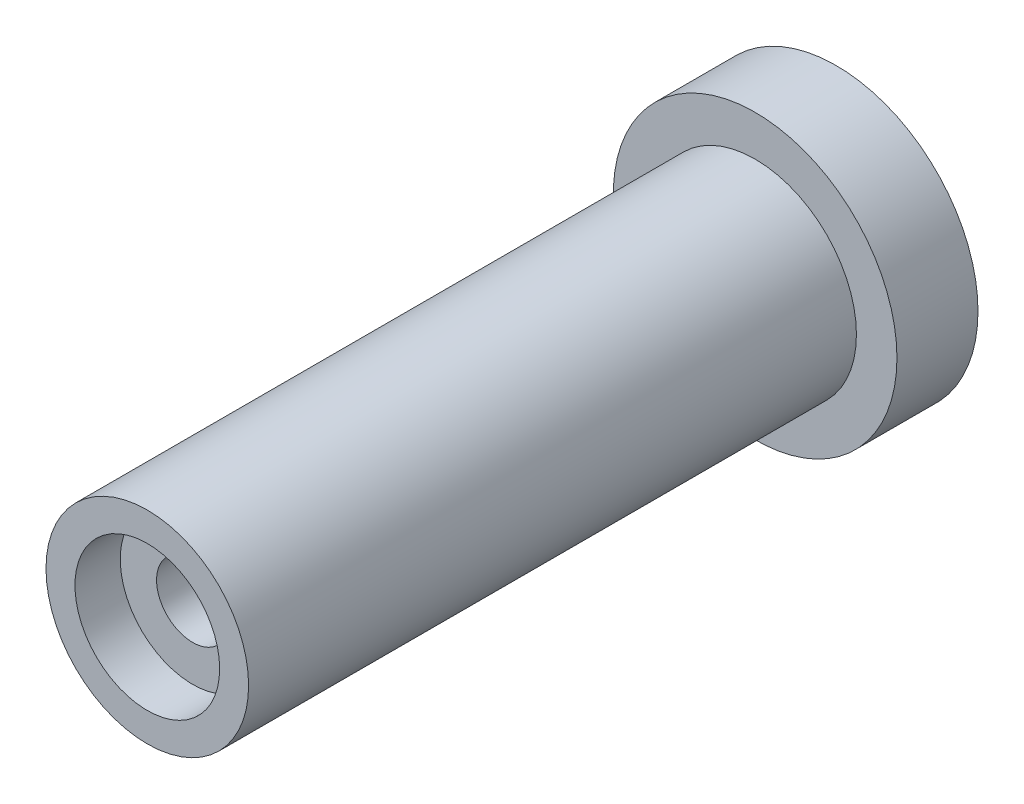
from build123d import *

# Parameters (mm, degrees)
ESQUISSE1_R                                      = 2.5
BOSS_EXTRU_1_DEPTH                               = 15
ESQUISSE2_R                                      = 3.5
BOSS_EXTRU_2_DEPTH                               = 2
CHAMBRAGE_POUR_VIS_T_TE_RONDE_BOMB_E_D           = 1.778
CHAMBRAGE_POUR_VIS_T_TE_RONDE_BOMB_E_DEPTH       = 6
CHAMBRAGE_POUR_VIS_T_TE_RONDE_BOMB_E_CBORE_D     = 3.57124
CHAMBRAGE_POUR_VIS_T_TE_RONDE_BOMB_E_CBORE_DEPTH = 1.1176
CHAMBRAGE_POUR_VIS_T_TE_RONDE_BOMB_E_TIP         = 0.53416509


with BuildPart() as part:
    # Esquisse1 → Boss.-Extru.1 (new body)
    with BuildSketch(Plane.XY):
        Circle(ESQUISSE1_R)
    extrude(amount=BOSS_EXTRU_1_DEPTH)

    # Esquisse2 → Boss.-Extru.2 (add)
    with BuildSketch(Plane.XY):
        Circle(ESQUISSE2_R)
        Polygon((-1.718731116, -0.115769453), (-1.718731116, 0.115769453), (-0.115769453, 0.115769453), (-0.115769453, 1.718731116), (0.115769453, 1.718731116), (0.115769453, 0.115769453), (1.718731116, 0.115769453), (1.718731116, -0.115769453), (0.115769453, -0.115769453), (0.115769453, -1.718731116), (-0.115769453, -1.718731116), (-0.115769453, -0.115769453), align=None, mode=Mode.SUBTRACT)
    extrude(amount=-BOSS_EXTRU_2_DEPTH)

    # Chambrage pour vis à tête ronde bombée #01
    with Locations(Plane.XY.offset(15)):
        with Locations((0, 0)):
            CounterBoreHole(CHAMBRAGE_POUR_VIS_T_TE_RONDE_BOMB_E_D / 2, CHAMBRAGE_POUR_VIS_T_TE_RONDE_BOMB_E_CBORE_D / 2, CHAMBRAGE_POUR_VIS_T_TE_RONDE_BOMB_E_CBORE_DEPTH, depth=CHAMBRAGE_POUR_VIS_T_TE_RONDE_BOMB_E_DEPTH)
            with Locations((0, 0, -(CHAMBRAGE_POUR_VIS_T_TE_RONDE_BOMB_E_DEPTH + CHAMBRAGE_POUR_VIS_T_TE_RONDE_BOMB_E_TIP / 2))):  # 118° drill point
                Cone(0, CHAMBRAGE_POUR_VIS_T_TE_RONDE_BOMB_E_D / 2, CHAMBRAGE_POUR_VIS_T_TE_RONDE_BOMB_E_TIP, mode=Mode.SUBTRACT)


solid = part.part
